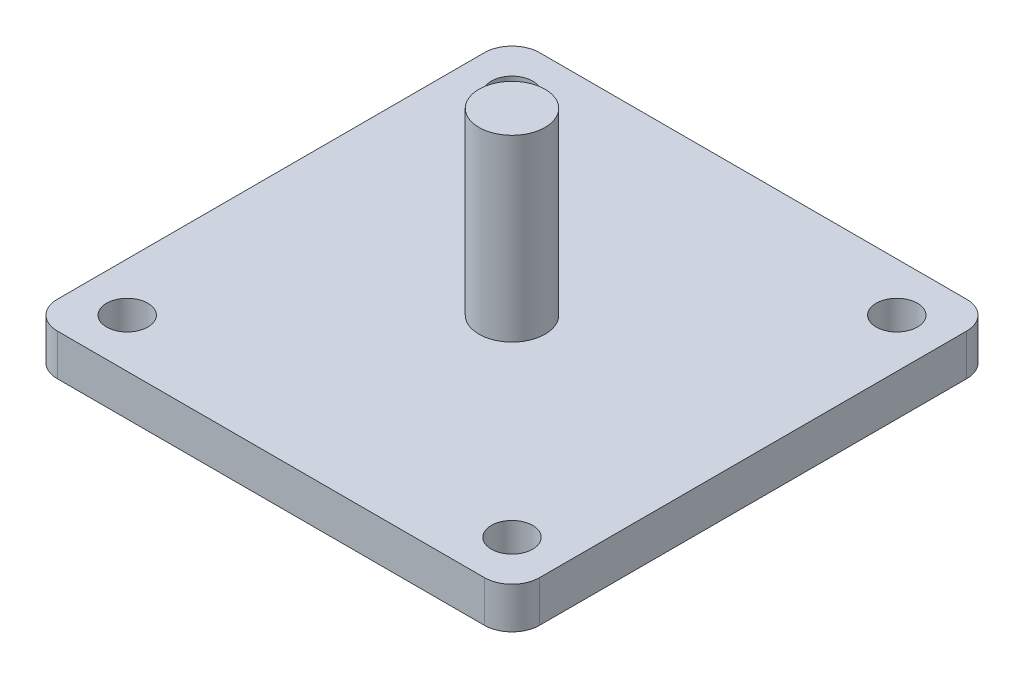
from build123d import *

# Parameters (mm, degrees)
ESBO_O1_W                = 35
ESBO_O1_H                = 35
RESSALTO_EXTRUS_O1_DEPTH = 1.5
FILETE1_R                = 2
ESBO_O2_R                = 2.4
RESSALTO_EXTRUS_O2_DEPTH = 13
ESBO_O3_R                = 1.5
CORTE_EXTRUS_O1_DEPTH    = 10


with BuildPart() as part:
    # Esboço1 → Ressalto-extrusão1 (new, symmetric)
    with BuildSketch(Plane(origin=(0, 0, 0), x_dir=(1, 0, 0), z_dir=(0, 1, 0))):
        Rectangle(ESBO_O1_W, ESBO_O1_H)
    extrude(amount=RESSALTO_EXTRUS_O1_DEPTH, both=True)

    # Filete1
    filete1_edges = [part.edges().sort_by_distance(p)[0] for p in [
        (-17.5, 0, 17.5),
        (-17.5, 0, -17.5),
        (17.5, 0, -17.5),
        (17.5, 0, 17.5),
    ]]
    fillet(filete1_edges, radius=FILETE1_R)

    # Esboço2 → Ressalto-extrusão2 (add)
    with BuildSketch(Plane(origin=(0, 1.5, 0), x_dir=(1, 0, 0), z_dir=(0, 1, 0))):
        Circle(ESBO_O2_R)
    extrude(amount=RESSALTO_EXTRUS_O2_DEPTH)

    # Esboço3 → Corte-extrusão1 (cut)
    with BuildSketch(Plane(origin=(0, 1.5, 0), x_dir=(1, 0, 0), z_dir=(0, 1, 0))):
        with Locations((13.964466094, 13.964466094)):
            Circle(ESBO_O3_R)
        with Locations((13.964466094, -13.964466094)):
            Circle(ESBO_O3_R)
        with Locations((-13.964466094, -13.964466094)):
            Circle(ESBO_O3_R)
        with Locations((-13.964466094, 13.964466094)):
            Circle(ESBO_O3_R)
    extrude(amount=-CORTE_EXTRUS_O1_DEPTH, mode=Mode.SUBTRACT)


solid = part.part
